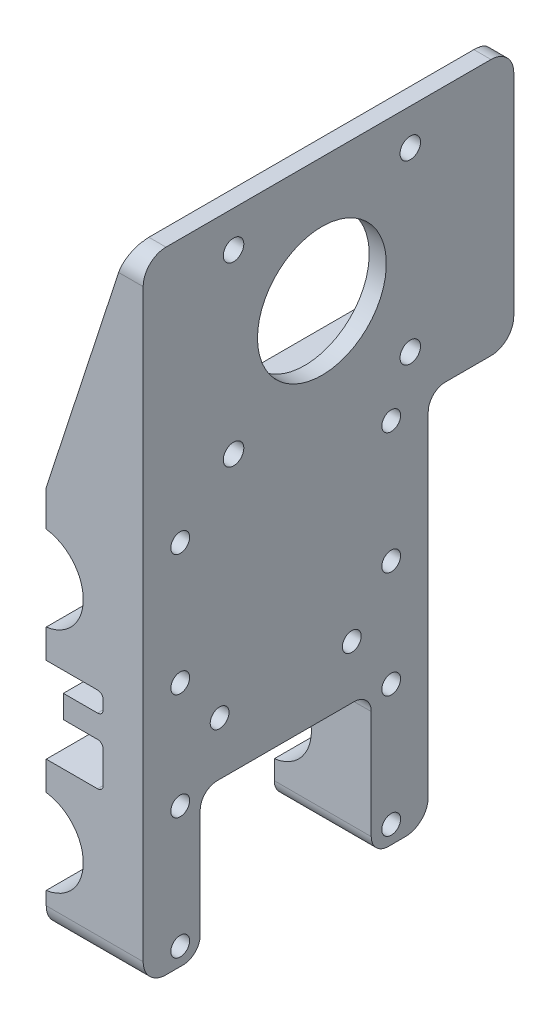
from build123d import *

# Parameters (mm, degrees)
SKETCH1_W               = 7
SKETCH1_H               = 67.54
BOSS_EXTRUDE1_DEPTH     = 50
SKETCH2_W               = 50
SKETCH2_H               = 26.27
BOSS_EXTRUDE2_DEPTH     = 10
SKETCH3_R               = 7.5
CUT_EXTRUDE1_DEPTH      = 62.827687164
SKETCH4_W               = 100
SKETCH4_H               = 30
CUT_EXTRUDE2_DEPTH      = 25
BOSS_EXTRUDE3_START     = -2
BOSS_EXTRUDE3_DEPTH     = 2
CUT_EXTRUDE3_DEPTH      = 63.685029313
CUT_EXTRUDE3_DEPTH_BACK = 63.685029313
SKETCH6_R               = 1.65
SKETCH7_W               = 65
SKETCH7_H               = 43
BOSS_EXTRUDE4_DEPTH     = 3
CUT_EXTRUDE4_DEPTH      = 94.180646596
CUT_EXTRUDE4_DEPTH_BACK = 94.180646596
SKETCH8_R               = 1.8
SKETCH8_R_2             = 11.3
CUT_EXTRUDE5_DEPTH      = 94.180646596
CUT_EXTRUDE5_DEPTH_BACK = 94.180646596
SKETCH11_R              = 1.65
SKETCH12_W              = 8
SKETCH12_H              = 4
BOSS_EXTRUDE6_DEPTH     = 7
SKETCH15_W              = 17
SKETCH15_H              = 15
BOSS_EXTRUDE7_DEPTH     = 2
FILLET4_R               = 3
FILLET5_R               = 3
FILLET6_R               = 1
BOSS_EXTRUDE8_DEPTH     = 3
BOSS_EXTRUDE9_DEPTH     = 3
FILLET7_R               = 4
CUT_EXTRUDE7_DEPTH      = 2.5


with BuildPart() as part:
    # Sketch1 → Boss-Extrude1 (new body)
    with BuildSketch(Plane.XY):
        Rectangle(SKETCH1_W, SKETCH1_H)
    extrude(amount=BOSS_EXTRUDE1_DEPTH)

    # Sketch2 → Boss-Extrude2 (add)
    with BuildSketch(Plane.ZY.offset(3.5)):
        with Locations((25, 20.635)):
            Rectangle(SKETCH2_W, SKETCH2_H)
        with Locations((25, -20.635)):
            Rectangle(SKETCH2_W, SKETCH2_H)
    extrude(amount=BOSS_EXTRUDE2_DEPTH)

    # Sketch3 → Cut-Extrude1 (cut, through all)
    with BuildSketch(Plane.XY.offset(50)):
        with Locations((-14.5, 20)):
            Circle(SKETCH3_R)
        with Locations((-14.5, -20)):
            Circle(SKETCH3_R)
    extrude(amount=-CUT_EXTRUDE1_DEPTH, mode=Mode.SUBTRACT)

    # Sketch4 → Cut-Extrude2 (cut)
    with BuildSketch(Plane.XZ.offset(33.77)):
        with Locations((13.05, 25)):
            Rectangle(SKETCH4_W, SKETCH4_H)
    extrude(amount=-CUT_EXTRUDE2_DEPTH, mode=Mode.SUBTRACT)

    # Sketch5 → Boss-Extrude3 (add)
    with BuildSketch(Plane(origin=(0, 0, 0), x_dir=(-1, 0, 0), z_dir=(0, 0, -1)).offset(BOSS_EXTRUDE3_START)):
        with BuildLine():
            Line((13.5, 27.433034374), (13.5, 25.916079783))
            ThreePointArc((13.5, 25.916079783), (8.5, 20), (13.5, 14.083920217))
            Line((13.5, 14.083920217), (13.5, 12.566965626))
            ThreePointArc((13.5, 12.566965626), (7, 20), (13.5, 27.433034374))
        make_face()
        with BuildLine():
            Line((13.5, -12.566965626), (13.5, -14.083920217))
            ThreePointArc((13.5, -14.083920217), (8.5, -20), (13.5, -25.916079783))
            Line((13.5, -25.916079783), (13.5, -27.433034374))
            ThreePointArc((13.5, -27.433034374), (7, -20), (13.5, -12.566965626))
        make_face()
    extrude(amount=BOSS_EXTRUDE3_DEPTH)

    # Sketch6 → Cut-Extrude3 (cut, two sides: drawn at the far end of the back side and taken through both)
    with BuildSketch(Plane(origin=(3.5, 0, 0), x_dir=(0, 0, -1), z_dir=(1, 0, 0)).offset(-CUT_EXTRUDE3_DEPTH_BACK)):
        with Locations(Location((-6.5, 30.65196164, 0), (0, 0, 180))):
            Circle(SKETCH6_R)
        with Locations(Location((-6.5, 9.34803836, 0), (0, 0, 180))):
            Circle(SKETCH6_R)
        with Locations(Location((-43.5, 9.34803836, 0), (0, 0, 180))):
            Circle(SKETCH6_R)
        with Locations(Location((-43.5, 30.65196164, 0), (0, 0, 180))):
            Circle(SKETCH6_R)
        with Locations((-43.5, -9.34803836)):
            Circle(SKETCH6_R)
        with Locations((-43.5, -30.65196164)):
            Circle(SKETCH6_R)
        with Locations((-6.5, -9.34803836)):
            Circle(SKETCH6_R)
        with Locations((-6.5, -30.65196164)):
            Circle(SKETCH6_R)
    extrude(amount=CUT_EXTRUDE3_DEPTH + CUT_EXTRUDE3_DEPTH_BACK, mode=Mode.SUBTRACT)

    # Sketch7 → Boss-Extrude4 (add)
    with BuildSketch(Plane(origin=(3.5, 0, 0), x_dir=(0, 0, -1), z_dir=(1, 0, 0))):
        with Locations((-17.5, 55.27)):
            Rectangle(SKETCH7_W, SKETCH7_H)
    extrude(amount=-BOSS_EXTRUDE4_DEPTH)

    # Sketch8 → Cut-Extrude4 (cut, two sides: drawn at the far end of the back side and taken through both)
    with BuildSketch(Plane(origin=(3.5, 0, 0), x_dir=(0, 0, -1), z_dir=(1, 0, 0)).offset(-CUT_EXTRUDE4_DEPTH_BACK)):
        with Locations(Location((-3.15, 70.42, 0), (0, 0, 180))):
            Circle(SKETCH8_R)
        with Locations(Location((-3.15, 39.42, 0), (0, 0, 180))):
            Circle(SKETCH8_R)
        with Locations(Location((-34.15, 70.42, 0), (0, 0, 180))):
            Circle(SKETCH8_R)
        with Locations(Location((-18.65, 54.92, 0), (0, 0, 180))):
            Circle(SKETCH8_R_2)
        with Locations(Location((-34.15, 39.42, 0), (0, 0, 180))):
            Circle(SKETCH8_R)
    extrude(amount=CUT_EXTRUDE4_DEPTH + CUT_EXTRUDE4_DEPTH_BACK, mode=Mode.SUBTRACT)

    # Sketch11 → Cut-Extrude5 (cut, two sides: drawn at the far end of the back side and taken through both)
    with BuildSketch(Plane(origin=(3.5, 0, 0), x_dir=(0, 0, -1), z_dir=(1, 0, 0)).offset(-CUT_EXTRUDE5_DEPTH_BACK)):
        with Locations((-36.590767043, 0.58)):
            Circle(SKETCH11_R)
        with Locations((-13.409232957, 0.58)):
            Circle(SKETCH11_R)
    extrude(amount=CUT_EXTRUDE5_DEPTH + CUT_EXTRUDE5_DEPTH_BACK, mode=Mode.SUBTRACT)

    # Sketch12 → Boss-Extrude6 (add)
    with BuildSketch(Plane.ZY.offset(3.5)):
        with Locations((4, 2)):
            Rectangle(SKETCH12_W, SKETCH12_H)
        with Locations((46, 2)):
            Rectangle(SKETCH12_W, SKETCH12_H)
    extrude(amount=BOSS_EXTRUDE6_DEPTH)

    # Sketch15 → Boss-Extrude7 (add)
    with BuildSketch(Plane.XZ.offset(-33.77)):
        with Locations((-5, -7.5)):
            Rectangle(SKETCH15_W, SKETCH15_H)
    extrude(amount=BOSS_EXTRUDE7_DEPTH)

    # Fillet4
    fillet4_edges = [part.edges().sort_by_distance(p)[0] for p in [
        (-5, 31.77, 0),
    ]]
    fillet(fillet4_edges, radius=FILLET4_R)

    # Fillet5
    fillet5_edges = [part.edges().sort_by_distance(p)[0] for p in [
        (-5, -33.77, 40),
        (-5, -33.77, 10),
        (-5, -8.77, 40),
        (-5, -8.77, 10),
    ]]
    fillet(fillet5_edges, radius=FILLET5_R)

    # Fillet6
    fillet6_edges = [part.edges().sort_by_distance(p)[0] for p in [
        (-3.5, 2, 8),
        (-3.5, 2, 42),
        (-3.5, 0, 46),
        (-3.5, 4, 46),
        (-3.5, 4, 4),
        (-3.5, 0, 4),
        (-3.5, 7.5, 25),
        (-3.5, -7.5, 25),
    ]]
    fillet(fillet6_edges, radius=FILLET6_R)

    # Sketch17 → Boss-Extrude8 (add)
    with BuildSketch(Plane.XY.offset(50)):
        Polygon((0.5, 76.77), (-13.5, 33.77), (0.5, 33.77), align=None)
    extrude(amount=-BOSS_EXTRUDE8_DEPTH)

    # Sketch18 → Boss-Extrude9 (add)
    with BuildSketch(Plane(origin=(0, 0, -15), x_dir=(-1, 0, 0), z_dir=(0, 0, -1))):
        Polygon((-0.5, 76.77), (13.5, 33.77), (-0.5, 33.77), align=None)
    extrude(amount=-BOSS_EXTRUDE9_DEPTH)

    # Fillet7
    # the kernel refuses this fillet: 4 mm, written as the material it takes off along each edge
    with BuildSketch(Plane(origin=(13.5, -33.77, 50), x_dir=(0, 1, 0), z_dir=(-1, 0, 0)), Plane(origin=(-23.5, -33.77, 0), x_dir=(0, 1, 0), z_dir=(1, 0, 0)), Plane(origin=(13.5, 31.77, -15), x_dir=(0, 0, 1), z_dir=(-1, 0, 0))) as fillet7_piece_1:
        with BuildLine():
            CenterArc((FILLET7_R, FILLET7_R), FILLET7_R, 180, 90)
            Line((0, FILLET7_R), (0, 0))
            Line((0, 0), (FILLET7_R, 0))
        make_face()
    extrude(amount=37, mode=Mode.SUBTRACT)
    with BuildSketch(Plane(origin=(13.5, 76.77, -15), x_dir=(0, -1, 0), z_dir=(-1, 0, 0))) as fillet7_piece_2:
        with BuildLine():
            CenterArc((FILLET7_R, FILLET7_R), FILLET7_R, 180, 90)
            Line((0, FILLET7_R), (0, 0))
            Line((0, 0), (FILLET7_R, 0))
        make_face()
    extrude(amount=23, mode=Mode.SUBTRACT)
    with BuildSketch(Plane(origin=(13.5, 76.77, 50), x_dir=(0, -1, 0), z_dir=(-1, 0, 0))) as fillet7_piece_3:
        with BuildLine():
            CenterArc((FILLET7_R, -FILLET7_R), FILLET7_R, 90, 90)
            Line((0, -FILLET7_R), (0, 0))
            Line((0, 0), (FILLET7_R, 0))
        make_face()
    extrude(amount=23, mode=Mode.SUBTRACT)

    # Sketch19 → Cut-Extrude7 (cut)
    with BuildSketch(Plane.ZY.offset(3.5)):
        Polygon((13.409232957, 3.870896534), (10.559232957, 2.225448267), (10.559232957, -1.065448267), (13.409232957, -2.710896534), (16.259232957, -1.065448267), (16.259232957, 2.225448267), align=None)
        Polygon((36.590767043, 3.870896534), (33.740767043, 2.225448267), (33.740767043, -1.065448267), (36.590767043, -2.710896534), (39.440767043, -1.065448267), (39.440767043, 2.225448267), align=None)
    extrude(amount=-CUT_EXTRUDE7_DEPTH, mode=Mode.SUBTRACT)


solid = part.part
